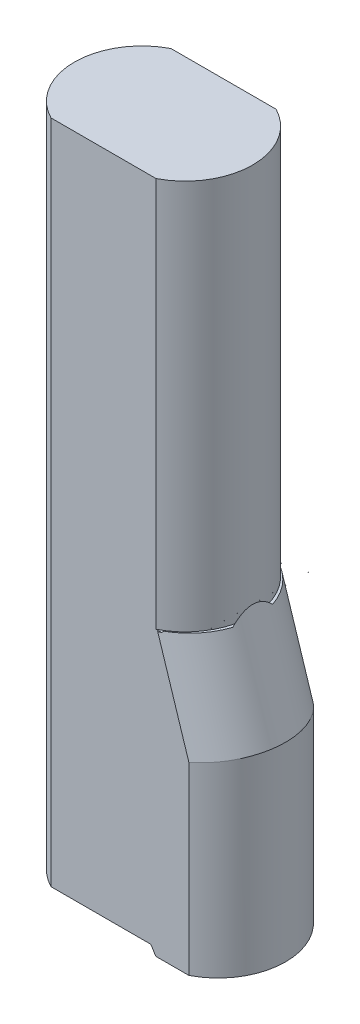
from build123d import *

# Parameters (mm, degrees)
BOSS_EXTRUDE1_DEPTH      = 30.3
CUT_EXTRUDE1_DEPTH       = 181.717957049
CUT_EXTRUDE7_DEPTH       = 27.29
CUT_EXTRUDE10_DEPTH      = 96
CUT_EXTRUDE11_DEPTH      = 48
SKETCH9_W                = 2
SKETCH9_H                = 7.4
BOSS_EXTRUDE2_DEPTH      = 1.5
FILLET8_R                = 1
CUT_EXTRUDE15_DEPTH      = 2.6
CUT_EXTRUDE15_DEPTH_BACK = 2.6
SKETCH10_W               = 29
SKETCH10_H               = 15.5
SKETCH11_W               = 3.45
SKETCH11_H               = 8
BOSS_EXTRUDE3_DEPTH      = 1.3
FILLET9_R                = 7
CUT_EXTRUDE18_DEPTH      = 2.5
CUT_EXTRUDE23_START      = -2.5
CUT_EXTRUDE23_DEPTH      = 2.5
SKETCH18_W               = 4.5
SKETCH18_H               = 15
SKETCH18_W_2             = 3.45
SKETCH18_H_2             = 8
CUT_EXTRUDE24_DEPTH      = 1


# Read off the part's stored shape, not the designer's step: Cut-Extrude23
# Some blends are built 0.0001 mm under size
with BuildPart() as part:
    # Sketch1 → Boss-Extrude1 (new body)
    with BuildSketch(Plane.XY):
        Polygon((34.45, 2), (35.7, 0), (53.3, 0), (53.3, 48), (45, 74), (45, 170), (0, 170), (0, 2), align=None)
    extrude(amount=BOSS_EXTRUDE1_DEPTH)

    # Sketch2 → Cut-Extrude1 (cut, through all)
    with BuildSketch(Plane(origin=(0, 170, 0), x_dir=(1, 0, 0), z_dir=(0, 1, 0))):
        with BuildLine():
            Line((0, -30.3), (9.25, -30.3))
            ThreePointArc((9.25, -30.3), (2.495291793, -24.025316905), (0, -15.150000022))
            Line((0, -15.150000022), (0, -30.3))
        make_face()
        with BuildLine():
            ThreePointArc((0, -15.150000022), (2.495291781, -6.274683113), (9.25, 0))
            Line((9.25, 0), (0, 0))
            Line((0, 0), (0, -15.150000022))
        make_face()
    extrude(amount=-CUT_EXTRUDE1_DEPTH, mode=Mode.SUBTRACT)

    # Sketch7 → Cut-Extrude7 (cut)
    with BuildSketch(Plane(origin=(-8.97657775, 28.11940018, 0), x_dir=(0, 0, -1), z_dir=(0.30411092373144827, -0.9526366285563479, 0))):
        with BuildLine():
            Line((-15.15, 65.372856641), (-30.3, 65.372856641))
            Line((-30.3, 65.372856641), (-30.3, 56.120928382))
            ThreePointArc((-30.3, 56.120928382), (-24.02581935, 62.876979624), (-15.15, 65.372856641))
        make_face()
        with BuildLine():
            Line((0, 65.372856641), (-15.15, 65.372856641))
            ThreePointArc((-15.15, 65.372856641), (-6.27418065, 62.876979624), (0, 56.120928382))
            Line((0, 56.120928382), (0, 65.372856641))
        make_face()
    extrude(amount=-CUT_EXTRUDE7_DEPTH, mode=Mode.SUBTRACT)

    # Sketch6 → Cut-Extrude10 (cut)
    with BuildSketch(Plane(origin=(0, 170, 0), x_dir=(1, 0, 0), z_dir=(0, 1, 0))):
        with BuildLine():
            Line((45, -15.15), (45, 0))
            Line((45, 0), (35.74807174, 0))
            ThreePointArc((35.74807174, 0), (42.504122982, -6.27418065), (45, -15.15))
        make_face()
        with BuildLine():
            Line((45, -30.3), (45, -15.15))
            ThreePointArc((45, -15.15), (42.504122982, -24.02581935), (35.74807174, -30.3))
            Line((35.74807174, -30.3), (45, -30.3))
        make_face()
    extrude(amount=-CUT_EXTRUDE10_DEPTH, mode=Mode.SUBTRACT)

    # Sketch4 → Cut-Extrude11 (cut)
    with BuildSketch(Plane.XZ):
        with BuildLine():
            Line((53.3, 15.15), (53.3, 30.3))
            Line((53.3, 30.3), (44.04807174, 30.3))
            ThreePointArc((44.04807174, 30.3), (50.804122982, 24.02581935), (53.3, 15.15))
        make_face()
        with BuildLine():
            Line((53.3, 0), (53.3, 15.15))
            ThreePointArc((53.3, 15.15), (50.804122982, 6.27418065), (44.04807174, 0))
            Line((44.04807174, 0), (53.3, 0))
        make_face()
    extrude(amount=-CUT_EXTRUDE11_DEPTH, mode=Mode.SUBTRACT)

    # Sketch9 → Boss-Extrude2 (add)
    with BuildSketch(Plane.XZ.offset(-2)):
        with Locations((3, 15.15)):
            Rectangle(SKETCH9_W, SKETCH9_H)
    extrude(amount=BOSS_EXTRUDE2_DEPTH)

    # Fillet8
    fillet8_edges = [part.edges().sort_by_distance(p)[0] for p in [
        (4, 1.25, 11.45),
        (2, 1.25, 11.45),
        (4, 1.25, 18.85),
        (2, 1.25, 18.85),
    ]]
    fillet(fillet8_edges, radius=FILLET8_R - 0.0001)  # a hair under: the kernel refuses the full size

    # Sketch10 → Cut-Extrude15 (cut, two sides: drawn at the far end of the back side and taken through both)
    with BuildSketch(Plane.XZ.offset(-2).offset(-CUT_EXTRUDE15_DEPTH_BACK)):
        with Locations((21, 15.15)):
            Rectangle(SKETCH10_W, SKETCH10_H)
    extrude(amount=CUT_EXTRUDE15_DEPTH + CUT_EXTRUDE15_DEPTH_BACK, mode=Mode.SUBTRACT)

    # Sketch11 → Boss-Extrude3 (add)
    with BuildSketch(Plane.XZ):
        with Locations((43.575, 15.15)):
            Rectangle(SKETCH11_W, SKETCH11_H)
    extrude(amount=BOSS_EXTRUDE3_DEPTH)

    # Fillet9
    # the kernel refuses this fillet: 7 mm, written as the material it takes off along each edge
    with BuildSketch(Plane(origin=(55.458124827, -1.3, 11.15), x_dir=(0, 1, 0), z_dir=(-1, 0, 0)), Plane(origin=(31.691875173, -1.3, 19.15), x_dir=(0, 1, 0), z_dir=(1, 0, 0))) as fillet9_piece_1:
        with BuildLine():
            CenterArc((7, -4.063249931), FILLET9_R, 144.516796045, 35.483203955)
            Line((0, -4.063249931), (-0.14, -4.063249931))
            Line((-0.14, -4.063249931), (-0.14, 0))
            Line((-0.14, 0), (0, 0.14))
            ThreePointArc((0, 0.14), (0.65, 0.14), (1.186, 0.081264999))
            Line((1.186, 0.081264999), (1.3, 0))
        make_face()
    extrude(amount=23.766249654, mode=Mode.SUBTRACT)

    # Sketch13 → Cut-Extrude18 (cut)
    with BuildSketch(Plane(origin=(0, 74, 0), x_dir=(1, 0, 0), z_dir=(0, 1, 0))):
        with BuildLine():
            Line((35.74807174, -30.3), (45, -30.3))
            Line((45, -30.3), (45, -15.15))
            ThreePointArc((45, -15.15), (42.504122982, -24.02581935), (35.74807174, -30.3))
        make_face()
    extrude(amount=-CUT_EXTRUDE18_DEPTH, mode=Mode.SUBTRACT)

    # Cut-Extrude23 outline → Cut-Extrude23 (cut)
    with BuildSketch(Plane(origin=(0, 74, 0), x_dir=(1, 0, 0), z_dir=(0, 1, 0)).offset(CUT_EXTRUDE23_START)):
        with BuildLine():
            ThreePointArc((44.999624541, -15.036915931), (44.999829684, -15.061319249), (45, -15.085722835))
            Line((45, -15.085722835), (45, 0))
            Line((45, 0), (35.74807174, 0))
            ThreePointArc((35.74807174, 0), (42.474573722, -6.225973939), (44.999624541, -15.036915931))
        make_face()
    extrude(amount=CUT_EXTRUDE23_DEPTH, mode=Mode.SUBTRACT)

    # Sketch18 → Cut-Extrude24 (cut)
    with BuildSketch(Plane.XZ):
        with Locations((43.575, 15.15)):
            Rectangle(SKETCH18_W, SKETCH18_H)
        with Locations((43.575, 15.15)):
            Rectangle(SKETCH18_W_2, SKETCH18_H_2, mode=Mode.SUBTRACT)
    extrude(amount=-CUT_EXTRUDE24_DEPTH, mode=Mode.SUBTRACT)


solid = part.part
